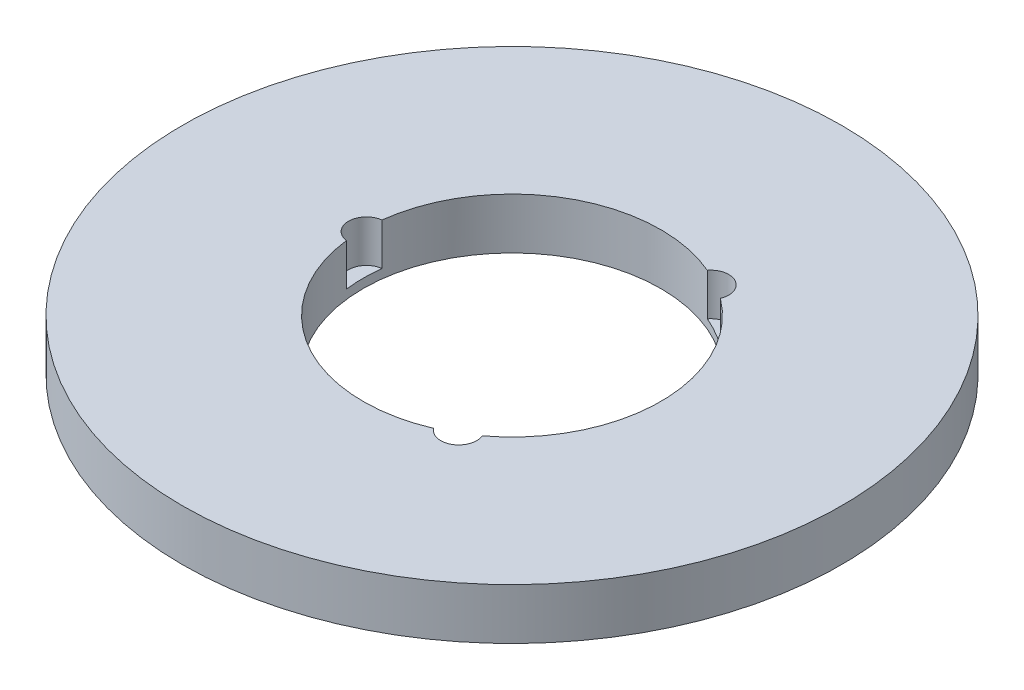
from build123d import *

# Parameters (mm, degrees)
SKETCH1_R           = 77.5
BOSS_EXTRUDE1_DEPTH = 12
SKETCH2_R           = 35
CUT_EXTRUDE1_DEPTH  = 111.256519082
SKETCH3_R           = 4.215961695
CUT_EXTRUDE2_DEPTH  = 9.886772192
CIRPATTERN1_COUNT   = 3


with BuildPart() as part:
    # Sketch1 → Boss-Extrude1 (new body)
    with BuildSketch(Plane(origin=(0, 0, 0), x_dir=(1, 0, 0), z_dir=(0, 1, 0))):
        Circle(SKETCH1_R)
    extrude(amount=BOSS_EXTRUDE1_DEPTH)

    # Sketch2 → Cut-Extrude1 (cut, through all)
    with BuildSketch(Plane(origin=(0, 0, 0), x_dir=(1, 0, 0), z_dir=(0, 1, 0))):
        Circle(SKETCH2_R)
    extrude(amount=CUT_EXTRUDE1_DEPTH, mode=Mode.SUBTRACT)

    # Sketch3 → Cut-Extrude2 (cut)
    with BuildSketch(Plane(origin=(0, 12, 0), x_dir=(1, 0, 0), z_dir=(0, 1, 0))):
        with Locations((-34.225330754, 0)):
            Circle(SKETCH3_R)
    cut_extrude2 = extrude(amount=-CUT_EXTRUDE2_DEPTH, mode=Mode.SUBTRACT)

    # CirPattern1: Cut-Extrude2 ×3 about axis
    cirpattern1_axis = Axis((0, 0, 0), (0, 1, 0))
    for i in range(1, CIRPATTERN1_COUNT):
        add(cut_extrude2.rotate(cirpattern1_axis, i * 360 / CIRPATTERN1_COUNT), mode=Mode.SUBTRACT)


solid = part.part
